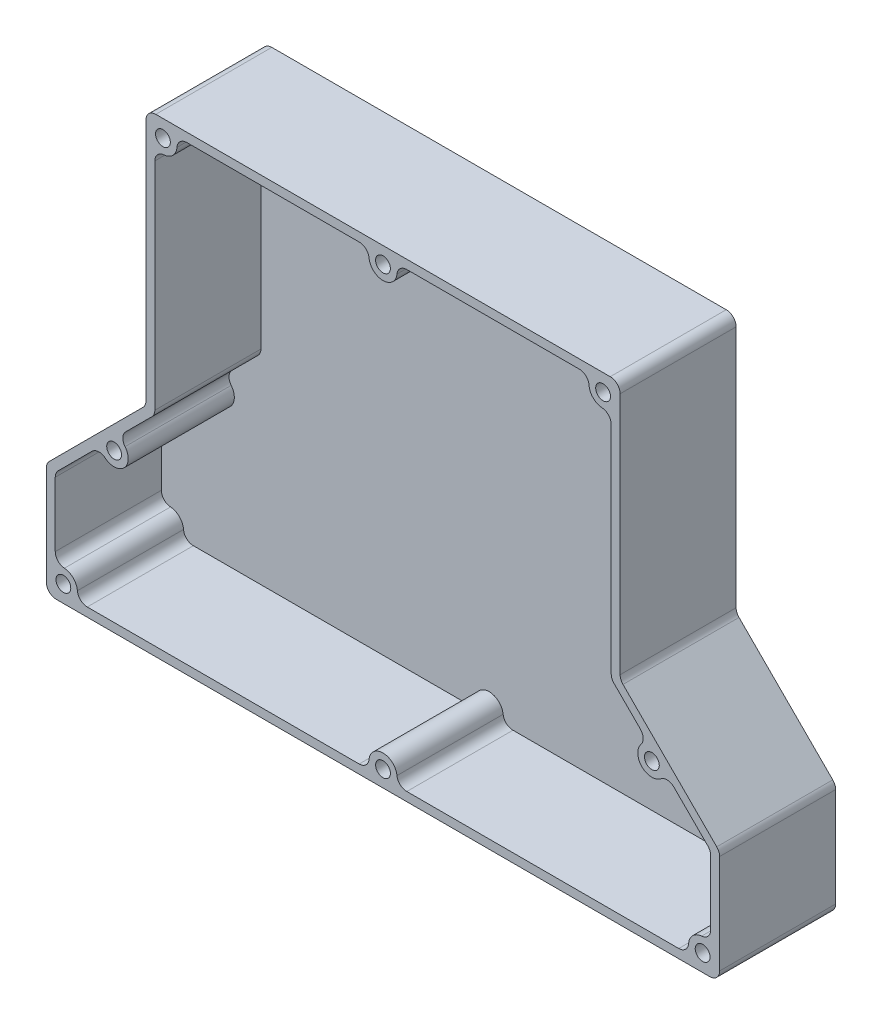
from build123d import *

# Parameters (mm, degrees)
BOSS_EXTRUDE1_DEPTH       = 2
BOSS_EXTRUDE2_DEPTH       = 21.5
FILLET1_R                 = 2
FILLET2_R                 = 2
BOSS_EXTRUDE3_START       = -22
BOSS_EXTRUDE3_OUTLINE_R   = 1.498302823
BOSS_EXTRUDE3_OUTLINE_R_2 = 1.5
BOSS_EXTRUDE3_DEPTH       = 22
FILLET3_R                 = 2


with BuildPart() as part:
    # Sketch3 → Boss-Extrude1 (new body)
    with BuildSketch(Plane.XY):
        Polygon((-15.640963985, -84.058941087), (4.526340861, -63.891636241), (4.526340861, -11.788708514), (100.581340861, -11.788708514), (100.581340861, -63.896636241), (120.743645706, -84.058941087), (120.743645706, -106.958318205), (104.551340861, -106.958318205), (-15.640963985, -106.958318205), (-15.640963985, -90.76601336), align=None)
    extrude(amount=-BOSS_EXTRUDE1_DEPTH)

    # Sketch3<3> → Boss-Extrude2 (add)
    with BuildSketch(Plane.XY):
        Polygon((-15.640963985, -90.76601336), (-15.640963985, -84.058941087), (4.526340861, -63.891636241), (4.526340861, -11.788708514), (100.581340861, -11.788708514), (100.581340861, -63.896636241), (120.743645706, -84.058941087), (120.743645706, -106.958318205), (104.551340861, -106.958318205), (-15.640963985, -106.958318205), align=None)
        Polygon((-13.840963985, -90.76601336), (-13.840963985, -105.158318205), (104.551340861, -105.158318205), (118.943645706, -105.158318205), (118.943645706, -84.804525499), (98.781340861, -64.642220653), (98.781340861, -13.588708514), (6.326340861, -13.588708514), (6.326340861, -64.637220653), (-13.840963985, -84.804525499), align=None, mode=Mode.SUBTRACT)
    extrude(amount=BOSS_EXTRUDE2_DEPTH)

    # Fillet1
    fillet1_edges = [part.edges().sort_by_distance(p)[0] for p in [
        (-15.640963985, -84.058941087, 9.75),
        (4.526340861, -63.891636241, 9.75),
        (4.526340861, -11.788708514, 9.75),
        (100.581340861, -11.788708514, 9.75),
        (100.581340861, -63.896636241, 9.75),
        (120.743645706, -84.058941087, 9.75),
        (120.743645706, -106.958318205, 9.75),
        (-15.640963985, -106.958318205, 9.75),
        (-13.840963985, -105.158318205, 10.75),
        (-13.840963985, -84.804525499, 10.75),
        (6.326340861, -64.637220653, 10.75),
        (6.326340861, -13.588708514, 10.75),
        (98.781340861, -13.588708514, 10.75),
        (98.781340861, -64.642220653, 10.75),
        (118.943645706, -105.158318205, 10.75),
    ]]
    fillet(fillet1_edges, radius=FILLET1_R)

    # Fillet2
    fillet2_edges = [part.edges().sort_by_distance(p)[0] for p in [
        (118.943645706, -84.804525499, 10.75),
    ]]
    fillet(fillet2_edges, radius=FILLET2_R)

    # Boss-Extrude3: read off the stored shape, not the designer's step
    # Boss-Extrude3 outline → Boss-Extrude3 (add)
    with BuildSketch(Plane.XY.offset(21.5).offset(BOSS_EXTRUDE3_START)):
        with BuildLine():
            ThreePointArc((101.167127298, -64.482422679), (100.733581796, -63.833575981), (100.581340861, -63.068209116))
            Line((100.581340861, -63.068209116), (100.581340861, -13.788708514))
            ThreePointArc((100.581340861, -13.788708514), (99.995554423, -12.374494952), (98.581340861, -11.788708514))
            Line((98.581340861, -11.788708514), (6.526340861, -11.788708514))
            ThreePointArc((6.526340861, -11.788708514), (5.112127298, -12.374494952), (4.526340861, -13.788708514))
            Line((4.526340861, -13.788708514), (4.526340861, -63.063209116))
            ThreePointArc((4.526340861, -63.063209116), (4.374099926, -63.828575981), (3.940554423, -64.477422679))
            Line((3.940554423, -64.477422679), (-15.055177547, -83.473154649))
            ThreePointArc((-15.055177547, -83.473154649), (-15.48872305, -84.122001347), (-15.640963985, -84.887368211))
            Line((-15.640963985, -84.887368211), (-15.640963985, -104.958318205))
            ThreePointArc((-15.640963985, -104.958318205), (-15.055177547, -106.372531767), (-13.640963985, -106.958318205))
            Line((-13.640963985, -106.958318205), (118.743645706, -106.958318205))
            ThreePointArc((118.743645706, -106.958318205), (120.157859269, -106.372531767), (120.743645706, -104.958318205))
            Line((120.743645706, -104.958318205), (120.743645706, -84.887368211))
            ThreePointArc((120.743645706, -84.887368211), (120.591404771, -84.122001347), (120.157859269, -83.473154649))
            Line((120.157859269, -83.473154649), (101.167127298, -64.482422679))
        make_face()
        with Locations((-12.195717461, -103.513071681)):
            Circle(BOSS_EXTRUDE3_OUTLINE_R, mode=Mode.SUBTRACT)
        with Locations((-1.913886606, -74.998768464)):
            Circle(BOSS_EXTRUDE3_OUTLINE_R_2, mode=Mode.SUBTRACT)
        with Locations((52.551340861, -103.658318205)):
            Circle(BOSS_EXTRUDE3_OUTLINE_R_2, mode=Mode.SUBTRACT)
        with Locations((117.297199097, -103.511871596)):
            Circle(BOSS_EXTRUDE3_OUTLINE_R_2, mode=Mode.SUBTRACT)
        with Locations((107.016568327, -74.998768464)):
            Circle(BOSS_EXTRUDE3_OUTLINE_R_2, mode=Mode.SUBTRACT)
        with BuildLine():
            ThreePointArc((-13.840963985, -85.632952624), (-13.68872305, -84.867585759), (-13.255177547, -84.218739061))
            Line((-13.255177547, -84.218739061), (-4.688095726, -75.651657241))
            ThreePointArc((-4.688095726, -75.651657241), (0.101367721, -77.01402279), (-1.260997829, -72.224559343))
            Line((-1.260997829, -72.224559343), (5.740554423, -65.223007091))
            ThreePointArc((5.740554423, -65.223007091), (6.174099926, -64.574160393), (6.326340861, -63.808793529))
            Line((6.326340861, -63.808793529), (6.326340861, -17.561464123))
            ThreePointArc((6.326340861, -17.561464123), (9.988041797, -17.25040945), (10.29909647, -13.588708514))
            Line((10.29909647, -13.588708514), (50.130516698, -13.588708514))
            ThreePointArc((50.130516698, -13.588708514), (52.553840861, -17.938708514), (54.977165024, -13.588708514))
            Line((54.977165024, -13.588708514), (94.808585252, -13.588708514))
            ThreePointArc((94.808585252, -13.588708514), (95.119639925, -17.25040945), (98.781340861, -17.561464123))
            Line((98.781340861, -17.561464123), (98.781340861, -63.813793529))
            ThreePointArc((98.781340861, -63.813793529), (98.933581796, -64.579160393), (99.367127298, -65.228007091))
            Line((99.367127298, -65.228007091), (106.36367955, -72.224559343))
            ThreePointArc((106.36367955, -72.224559343), (105.001314001, -77.01402279), (109.790777448, -75.651657241))
            Line((109.790777448, -75.651657241), (118.357859269, -84.218739061))
            ThreePointArc((118.357859269, -84.218739061), (118.791404771, -84.867585759), (118.943645706, -85.632952624))
            Line((118.943645706, -85.632952624), (118.943645706, -101.185562596))
            ThreePointArc((118.943645706, -101.185562596), (115.28194477, -101.496617269), (114.970890097, -105.158318205))
            Line((114.970890097, -105.158318205), (54.974665024, -105.158318205))
            ThreePointArc((54.974665024, -105.158318205), (52.551340861, -100.808318205), (50.128016698, -105.158318205))
            Line((50.128016698, -105.158318205), (-9.870638356, -105.158318205))
            ThreePointArc((-9.870638356, -105.158318205), (-10.18166322, -101.49901744), (-13.840963985, -101.187992576))
            Line((-13.840963985, -101.187992576), (-13.840963985, -85.632952624))
        make_face(mode=Mode.SUBTRACT)
        with Locations((7.97278747, -15.235155124)):
            Circle(BOSS_EXTRUDE3_OUTLINE_R_2, mode=Mode.SUBTRACT)
        with Locations((52.553840861, -15.088708514)):
            Circle(BOSS_EXTRUDE3_OUTLINE_R_2, mode=Mode.SUBTRACT)
        with Locations((97.134894251, -15.235155124)):
            Circle(BOSS_EXTRUDE3_OUTLINE_R_2, mode=Mode.SUBTRACT)
    extrude(amount=BOSS_EXTRUDE3_DEPTH)

    # Fillet3
    fillet3_edges = [part.edges().sort_by_distance(p)[0] for p in [
        (10.29909647, -13.588708514, 10.75),
        (6.326340861, -17.561464123, 10.75),
        (54.977165024, -13.588708514, 10.75),
        (50.130516698, -13.588708514, 10.75),
        (94.808585252, -13.588708514, 10.75),
        (98.781340861, -17.561464123, 10.75),
        (109.790777448, -75.651657241, 10.75),
        (106.36367955, -72.224559343, 10.75),
        (118.943645706, -101.185562596, 10.75),
        (114.970890097, -105.158318205, 10.75),
        (50.128016698, -105.158318205, 10.75),
        (54.974665024, -105.158318205, 10.75),
        (-9.870638356, -105.158318205, 10.75),
        (-13.840963985, -101.187992576, 10.75),
        (-4.688095726, -75.651657241, 10.75),
        (-1.260997829, -72.224559343, 10.75),
    ]]
    fillet(fillet3_edges, radius=FILLET3_R)


solid = part.part
